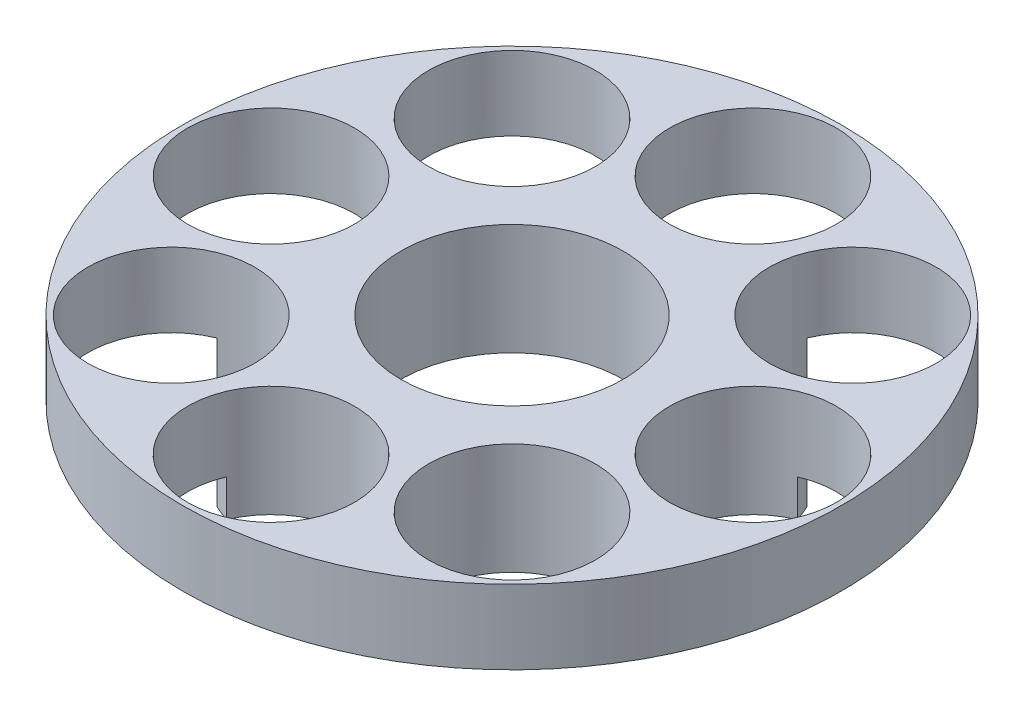
from build123d import *

# Parameters (mm, degrees)
SKETCH1_R           = 88.9
SKETCH1_R_2         = 22.5
SKETCH1_R_3         = 30
BOSS_EXTRUDE1_DEPTH = 30
CUT_EXTRUDE1_START  = -20
SKETCH2_R           = 90
SKETCH2_R_2         = 60
CUT_EXTRUDE1_DEPTH  = 20


with BuildPart() as part:
    # Sketch1 → Boss-Extrude1 (new body)
    with BuildSketch(Plane(origin=(0, 0, 0), x_dir=(1, 0, 0), z_dir=(0, 1, 0))):
        Circle(SKETCH1_R)
        with Locations((65, 0)):
            Circle(SKETCH1_R_2, mode=Mode.SUBTRACT)
        with Locations((45.961940777, 45.961940777)):
            Circle(SKETCH1_R_2, mode=Mode.SUBTRACT)
        with Locations((0, 65)):
            Circle(SKETCH1_R_2, mode=Mode.SUBTRACT)
        with Locations((-45.961940777, 45.961940777)):
            Circle(SKETCH1_R_2, mode=Mode.SUBTRACT)
        with Locations((-65, 0)):
            Circle(SKETCH1_R_2, mode=Mode.SUBTRACT)
        with Locations((-45.961940777, -45.961940777)):
            Circle(SKETCH1_R_2, mode=Mode.SUBTRACT)
        with Locations((0, -65)):
            Circle(SKETCH1_R_2, mode=Mode.SUBTRACT)
        with Locations((45.961940777, -45.961940777)):
            Circle(SKETCH1_R_2, mode=Mode.SUBTRACT)
        Circle(SKETCH1_R_3, mode=Mode.SUBTRACT)
    extrude(amount=BOSS_EXTRUDE1_DEPTH)

    # Sketch2 → Cut-Extrude1 (cut)
    with BuildSketch(Plane(origin=(0, 30, 0), x_dir=(1, 0, 0), z_dir=(0, 1, 0)).offset(CUT_EXTRUDE1_START)):
        Circle(SKETCH2_R)
        Circle(SKETCH2_R_2, mode=Mode.SUBTRACT)
    extrude(amount=-CUT_EXTRUDE1_DEPTH, mode=Mode.SUBTRACT)


solid = part.part
